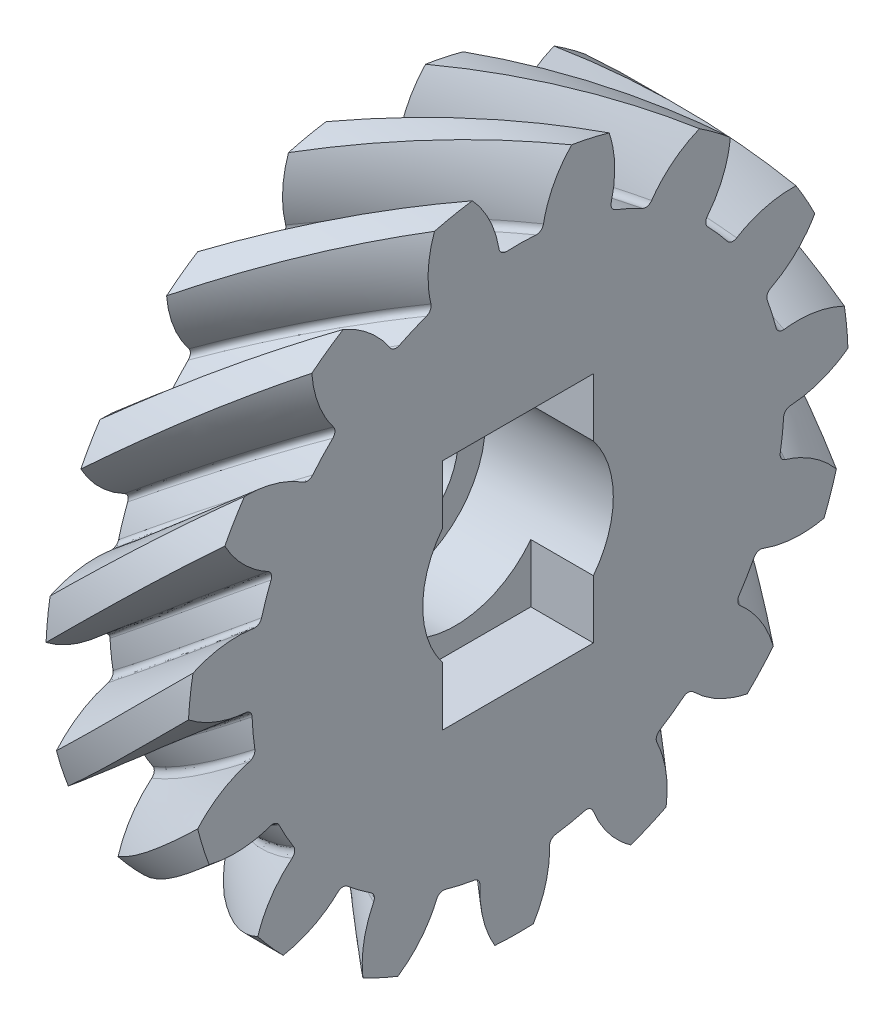
from build123d import *

# Parameters (mm, degrees)
BASPROSKE_W            = 5
BASPROSKE_H            = 11.606601718
TOOTHCUTLH_PITCH       = 72.92642938
TOOTHCUTLH_HEIGHT      = 5
TOOTHCUTLH_RADIUS      = 11.606601718
TOOTHCUTLH_START_ANGLE = -90
TEETHCUTSLH_COUNT      = 15
TEETHCUTSLH_ANGLE      = 336
BORSKE_R               = 2.4
BORE_DEPTH             = 62.5000025
SKETCH_1_R             = 3.35
CUT_EXTRUDE_1_DEPTH    = 4.5
SKETCH_3_W             = 5.3
SKETCH_3_H             = 8.2
CUT_EXTRUDE_2_DEPTH    = 2.2


with BuildPart() as part:
    # BasProSke → Base-Revolve (revolve)
    with BuildSketch(Plane(origin=(0, 0, 0), x_dir=(1, 0, 0), z_dir=(0, 1, 0)), mode=Mode.PRIVATE) as base_revolve_sk:
        with Locations((2.5, 5.803300859)):
            Rectangle(BASPROSKE_W, BASPROSKE_H)
    revolve(base_revolve_sk.sketch.rotate(Axis((-10, 0, 0), (1, 0, 0)), 180), axis=Axis((-10, 0, 0), (1, 0, 0)))

    # ToothCutLH: sweep along a helix
    with BuildLine() as toothcutlh_path:
        add(Helix(TOOTHCUTLH_PITCH, TOOTHCUTLH_HEIGHT, TOOTHCUTLH_RADIUS, center=(0, 0, 0), direction=(1, 0, 0), lefthand=True, mode=Mode.PRIVATE).rotate(Axis((0, 0, 0), (1, 0, 0)), TOOTHCUTLH_START_ANGLE))
    # TooCutSkeRH<3> → ToothCutLH (sweep, cut)
    with BuildSketch(Plane(origin=(0, 0, 0), x_dir=(0, 0, -1), z_dir=(1, 0, 0))):
        with BuildLine():
            ThreePointArc((0.520162537, 9.342131804), (0, 9.356601718), (-0.520162537, 9.342131804))
            ThreePointArc((-0.520162537, 9.342131804), (-0.69008972, 9.396088288), (-0.781322065, 9.549265339))
            ThreePointArc((-0.781322065, 9.549265339), (-1.227561058, 10.775594128), (-2.067030428, 11.774745124))
            ThreePointArc((-2.067030428, 11.774745124), (0, 11.954799769), (2.067030428, 11.774745124))
            ThreePointArc((2.067030428, 11.774745124), (1.227561058, 10.775594128), (0.781322065, 9.549265339))
            ThreePointArc((0.781322065, 9.549265339), (0.69008972, 9.396088288), (0.520162537, 9.342131804))
        make_face()
    toothcutlh = sweep(path=toothcutlh_path.line, is_frenet=True, mode=Mode.SUBTRACT)

    # TeethCutsLH: ToothCutLH ×15 about axis
    teethcutslh_axis = Axis((-10, 0, 0), (1, 0, 0))
    for i in range(1, TEETHCUTSLH_COUNT):
        add(toothcutlh.rotate(teethcutslh_axis, i * TEETHCUTSLH_ANGLE / (TEETHCUTSLH_COUNT - 1)), mode=Mode.SUBTRACT)

    # BorSke → Bore (cut, symmetric)
    with BuildSketch(Plane(origin=(0, 0, 0), x_dir=(0, 0, -1), z_dir=(1, 0, 0))):
        with Locations(Location((0, 0, 0), (0, 0, 180))):
            Circle(BORSKE_R)
    extrude(amount=BORE_DEPTH, both=True, mode=Mode.SUBTRACT)

    # 草圖1 → 除料-伸長1 (cut)
    with BuildSketch(Plane(origin=(5, 0, 0), x_dir=(0, 0, -1), z_dir=(1, 0, 0))):
        Circle(SKETCH_1_R)
    extrude(amount=-CUT_EXTRUDE_1_DEPTH, mode=Mode.SUBTRACT)

    # 草圖3 → 除料-伸長2 (cut)
    with BuildSketch(Plane(origin=(5, 0, 0), x_dir=(0, 0, -1), z_dir=(1, 0, 0))):
        Rectangle(SKETCH_3_W, SKETCH_3_H)
    extrude(amount=-CUT_EXTRUDE_2_DEPTH, mode=Mode.SUBTRACT)


solid = part.part
